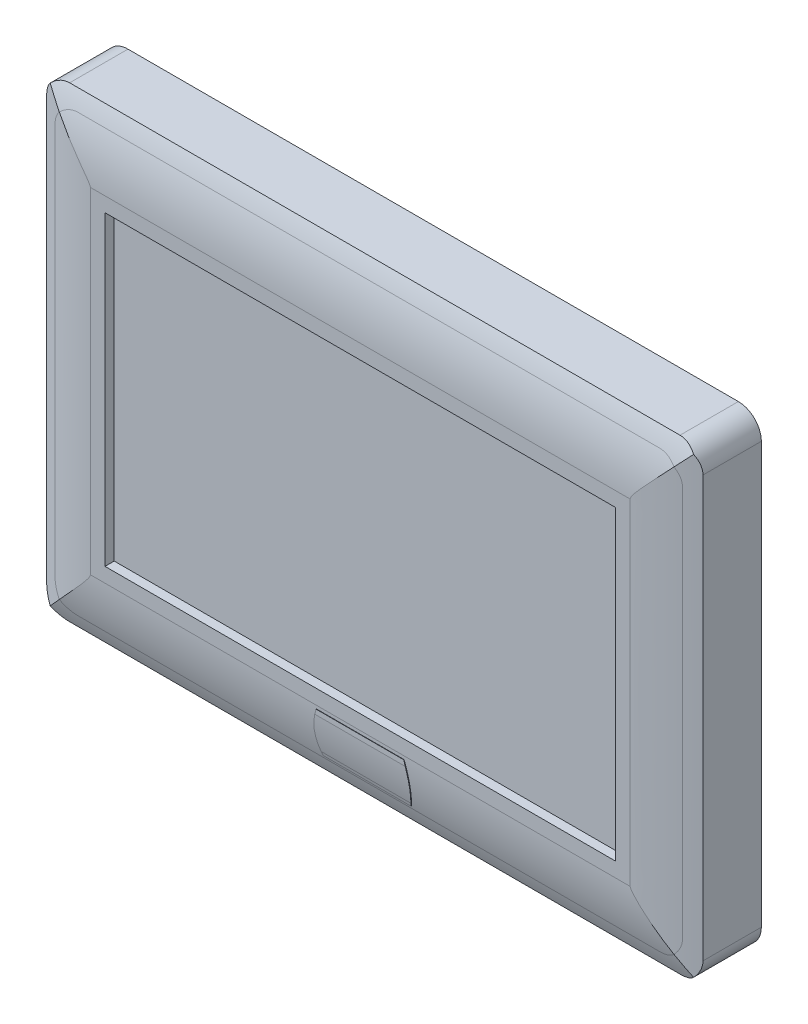
from build123d import *
from OCP.BRepAlgoAPI import BRepAlgoAPI_Cut
from OCP.TopTools import TopTools_ListOfShape

# Parameters (mm, degrees)
SKETCH1_W               = 285.75
SKETCH1_H               = 203.2
BOSS_EXTRUDE1_DEPTH     = 15.875
BOSS_EXTRUDE3_DEPTH     = 67.46875
SKETCH3_W               = 222.25
SKETCH3_H               = 133.35
CUT_EXTRUDE1_DEPTH      = 4
CUT_EXTRUDE2_DEPTH      = 150
CUT_EXTRUDE3_DEPTH      = 110
FILLET1_R               = 10
CUT_EXTRUDE5_DEPTH      = 8
BOSS_EXTRUDE4_DEPTH     = 4
CUT_EXTRUDE6_DEPTH      = 177.822705458
CUT_EXTRUDE6_DEPTH_BACK = 177.822705458


with BuildPart() as part:
    # Sketch1 → Boss-Extrude1 (new, symmetric)
    with BuildSketch(Plane.XY):
        Rectangle(SKETCH1_W, SKETCH1_H)
    extrude(amount=BOSS_EXTRUDE1_DEPTH, both=True)

    # Sketch2 → Boss-Extrude3 (add, symmetric)
    with BuildSketch(Plane(origin=(0, 0, 0), x_dir=(0, 0, -1), z_dir=(1, 0, 0))):
        with BuildLine():
            Line((15.875, -70.427878353), (15.875, -76.2))
            Line((15.875, -76.2), (17.82317764, -76.2))
            ThreePointArc((17.82317764, -76.2), (16.375177061, -73.473891504), (15.875, -70.427878353))
        make_face()
        with BuildLine():
            Line((15.875, 76.2), (15.875, -70.427878353))
            ThreePointArc((15.875, -70.427878353), (17.873814665, -64.589885641), (23.031358874, -61.202090387))
            Line((23.031358874, -61.202090387), (15.875, 76.2))
        make_face()
    extrude(amount=BOSS_EXTRUDE3_DEPTH, both=True)

    # Sketch3 → Cut-Extrude1 (cut)
    with BuildSketch(Plane.XY.offset(15.875)):
        Rectangle(SKETCH3_W, SKETCH3_H)
    extrude(amount=-CUT_EXTRUDE1_DEPTH, mode=Mode.SUBTRACT)

    # Sketch4 → Cut-Extrude2 (cut, symmetric)
    with BuildSketch(Plane(origin=(0, 0, 0), x_dir=(0, 0, -1), z_dir=(1, 0, 0))):
        with BuildLine():
            Line((-15.875, 101.6), (-9.525, 101.6))
            add(Edge.make_bspline(
                [(-15.875, 73.025), (-15.740007642, 87.660404276), (-9.525, 101.6)],
                knots=[0, 0, 0, 1, 1, 1], degree=2))
            Line((-15.875, 73.025), (-15.875, 101.6))
        make_face()
    cut_extrude2 = extrude(amount=CUT_EXTRUDE2_DEPTH, both=True, mode=Mode.SUBTRACT)

    # Sketch5 → Cut-Extrude3 (cut, symmetric)
    with BuildSketch(Plane(origin=(0, 0, 0), x_dir=(1, 0, 0), z_dir=(0, 1, 0))):
        with BuildLine():
            Line((-142.875, -15.875), (-142.875, -9.525))
            add(Edge.make_bspline(
                [(-117.475, -15.875), (-130.557631511, -15.410911921), (-142.875, -9.525)],
                knots=[0, 0, 0, 1, 1, 1], degree=2))
            Line((-117.475, -15.875), (-142.875, -15.875))
        make_face()
    cut_extrude3 = extrude(amount=CUT_EXTRUDE3_DEPTH, both=True, mode=Mode.SUBTRACT)

    # Mirror1: Cut-Extrude3 across plane
    add(cut_extrude3.mirror(Plane(origin=(0, 0, 0), x_dir=(0, 0, 1), z_dir=(1, 0, 0))), mode=Mode.SUBTRACT)

    # Mirror2: Cut-Extrude2 across plane
    add(cut_extrude2.mirror(Plane.ZX), mode=Mode.SUBTRACT)

    # Fillet1
    fillet1_edges = [part.edges().sort_by_distance(p)[0] for p in [
        (-142.875, -101.6, -3.175),
        (-142.875, 101.6, -3.175),
        (142.875, 101.6, -3.175),
        (142.875, -101.6, -3.175),
    ]]
    fillet(fillet1_edges, radius=FILLET1_R)

    # Sketch7 → Cut-Extrude5 (cut)
    with BuildSketch(Plane.XY.offset(20)):
        with BuildLine():
            Line((19.05, -74.445554322), (-19.05, -74.445554322))
            add(Edge.make_bspline(
                [(-19.05, -74.445554322), (-22.225, -83.970554322), (-19.05, -93.495554322)],
                knots=[0, 0, 0, 1, 1, 1], degree=2))
            Line((-19.05, -93.495554322), (19.05, -93.495554322))
            add(Edge.make_bspline(
                [(19.05, -74.445554322), (22.225, -83.970554322), (19.05, -93.495554322)],
                knots=[0, 0, 0, 1, 1, 1], degree=2))
        make_face()
    extrude(amount=-CUT_EXTRUDE5_DEPTH, mode=Mode.SUBTRACT)

    # Sketch8 → Boss-Extrude4 (add)
    with BuildSketch(Plane.XY.offset(12)):
        with BuildLine():
            Line((19.050000001, -74.445554325), (-19.05, -74.445554322))
            add(Edge.make_bspline(
                [(-19.05, -74.445554322), (-22.224999999, -83.97055432), (-19.050000001, -93.495554318)],
                knots=[0, 0, 0, 1, 1, 1], degree=2))
            Line((-19.050000001, -93.495554318), (19.049999993, -93.495554343))
            add(Edge.make_bspline(
                [(19.049999993, -93.495554343), (22.225000003, -83.970554334), (19.050000001, -74.445554325)],
                knots=[0, 0, 0, 1, 1, 1], degree=2))
        make_face()
    extrude(amount=BOSS_EXTRUDE4_DEPTH)


with BuildPart() as cut_extrude6_tool:
    # Sketch9 → Cut-Extrude6 (new, two sides: drawn at the far end of the back side and taken through both)
    with BuildSketch(Plane(origin=(0, 0, 0), x_dir=(0, 0, -1), z_dir=(1, 0, 0)).offset(-CUT_EXTRUDE6_DEPTH_BACK)):
        with BuildLine():
            add(Edge.make_bspline(
                [(-16, -76.619171068), (-15.98193693, -76.917627059), (-15.848587536, -78.908036237), (-15.4550304, -82.477341602), (-14.576735045, -87.283074638), (-13.781293961, -90.412631517), (-13.333086302, -91.95713173)],
                knots=[0.499842458, 0.499842458, 0.499842458, 0.499842458, 0.499880379, 0.500095611, 0.500298029, 0.500500448, 0.500500448, 0.500500448, 0.500500448], degree=3))
            Line((-16, -76.619171068), (-16, -93.495554343))
            Line((-16, -93.495554343), (-12.868171215, -93.495553835))
            add(Edge.make_bspline(
                [(-13.333086303, -91.95713173), (-13.220836971, -92.343937073), (-13.067813572, -92.855338395), (-12.908403114, -93.367525167), (-12.868171215, -93.495553835)],
                knots=[0.500500448, 0.500500448, 0.500500448, 0.500500448, 0.500550665, 0.500567404, 0.500567404, 0.500567404, 0.500567404], degree=3))
        make_face()
    extrude(amount=CUT_EXTRUDE6_DEPTH + CUT_EXTRUDE6_DEPTH_BACK)


with BuildPart() as part_1:
    add(part.part)

    # Cut-Extrude6: cut by cut_extrude6_tool, with a tolerance
    cut_extrude6_stock = TopTools_ListOfShape()
    cut_extrude6_stock.Append(part_1.part.wrapped)
    cut_extrude6_tools = TopTools_ListOfShape()
    cut_extrude6_tools.Append(cut_extrude6_tool.part.wrapped)
    cut_extrude6_cut = BRepAlgoAPI_Cut()
    cut_extrude6_cut.SetArguments(cut_extrude6_stock)
    cut_extrude6_cut.SetTools(cut_extrude6_tools)
    cut_extrude6_cut.SetFuzzyValue(0.00001)
    cut_extrude6_cut.Build()
    add(Compound.cast(cut_extrude6_cut.Shape()).solids(), mode=Mode.REPLACE)


solid = part_1.part
